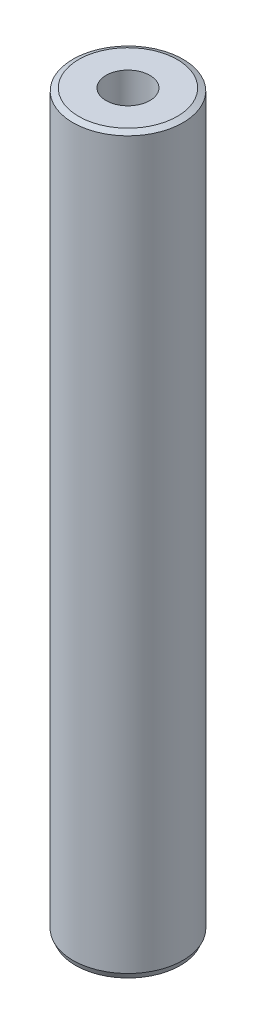
from build123d import *
from OCP.BRepFilletAPI import BRepFilletAPI_MakeChamfer

# Parameters (mm, degrees)
SKETCH1_R           = 45
BOSS_EXTRUDE1_DEPTH = 600
SKETCH2_R           = 17.928126053
CUT_EXTRUDE1_DEPTH  = 604.365560834
CHAMFER1_SIZE       = 2.10501896
CHAMFER1_SIZE2      = 4.681771617


with BuildPart() as part:
    # Sketch1 → Boss-Extrude1 (new body)
    with BuildSketch(Plane(origin=(0, 0, 0), x_dir=(1, 0, 0), z_dir=(0, 1, 0))):
        Circle(SKETCH1_R)
    extrude(amount=BOSS_EXTRUDE1_DEPTH)

    # Sketch2 → Cut-Extrude1 (cut, through all)
    with BuildSketch(Plane(origin=(0, 0, 0), x_dir=(1, 0, 0), z_dir=(0, 1, 0))):
        Circle(SKETCH2_R)
    extrude(amount=CUT_EXTRUDE1_DEPTH, mode=Mode.SUBTRACT)

    # Chamfer1: one chamfer whose edges measure the first distance from different faces: ONE call of the kernel's chamfer builder (chamfer() names one face for all edges)
    chamfer1_edges_1 = [part.edges().sort_by_distance(p)[0] for p in [
        (-45, 600, 0),
    ]]
    chamfer1_side_1 = [part.faces().sort_by_distance(p)[0] for p in [
        (-45, 300, 0),
    ]]
    chamfer1_edges_2 = [part.edges().sort_by_distance(p)[0] for p in [
        (-45, 0, 0),
    ]]
    chamfer1_side_2 = [part.faces().sort_by_distance(p)[0] for p in [
        (-43.727207794, 0, 0),
    ]]
    chamfer1 = BRepFilletAPI_MakeChamfer(part.part.solid().wrapped)
    for e in chamfer1_edges_1:
        chamfer1.Add(CHAMFER1_SIZE, CHAMFER1_SIZE2, e.wrapped, chamfer1_side_1[0].wrapped)  # the first distance lies on this face
    for e in chamfer1_edges_2:
        chamfer1.Add(CHAMFER1_SIZE, CHAMFER1_SIZE2, e.wrapped, chamfer1_side_2[0].wrapped)  # the first distance lies on this face
    add(Compound.cast(chamfer1.Shape()), mode=Mode.REPLACE)


solid = part.part
